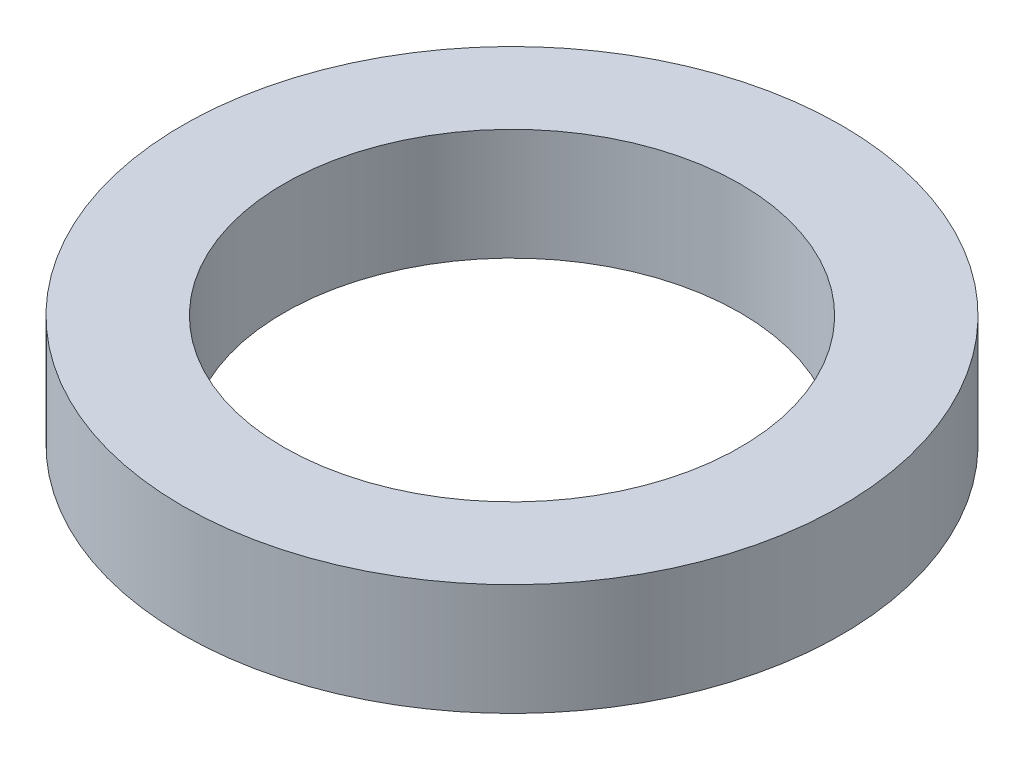
from build123d import *

# Parameters (mm, degrees)
SKETCH1_R           = 32.5
BOSS_EXTRUDE1_DEPTH = 11
SKETCH2_R           = 22.5
CUT_EXTRUDE1_DEPTH  = 48.259919594


with BuildPart() as part:
    # Sketch1 → Boss-Extrude1 (new body)
    with BuildSketch(Plane(origin=(0, 0, 0), x_dir=(1, 0, 0), z_dir=(0, 1, 0))):
        Circle(SKETCH1_R)
    extrude(amount=BOSS_EXTRUDE1_DEPTH)

    # Sketch2 → Cut-Extrude1 (cut, through all)
    with BuildSketch(Plane(origin=(0, 0, 0), x_dir=(1, 0, 0), z_dir=(0, 1, 0))):
        Circle(SKETCH2_R)
    extrude(amount=CUT_EXTRUDE1_DEPTH, mode=Mode.SUBTRACT)


solid = part.part
